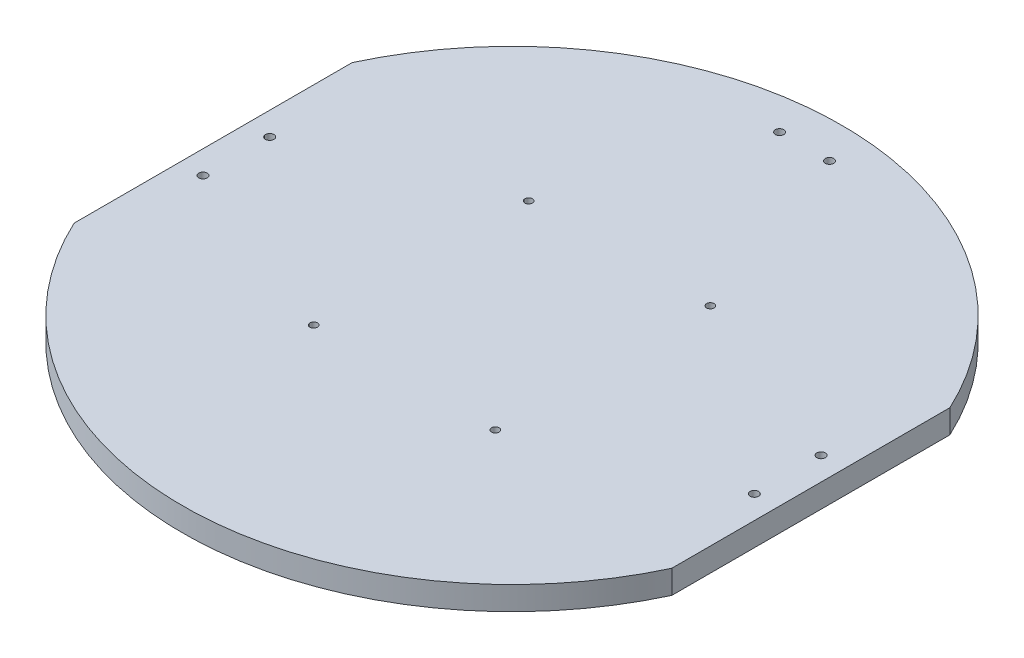
from build123d import *

# Parameters (mm, degrees)
MAIN_BODY_DEPTH    = 6.35
RASPBERRY_PI_REACH = 122.169
SKETCH2_R          = 1.025
MOTOR_MOUNTS_REACH = 122.169
SKETCH3_R          = 1.143
CUT_EXTRUDE3_REACH = 122.169
SKETCH4_R          = 1.143


with BuildPart() as part:
    # Sketch1 → Main Body (new body)
    with BuildSketch(Plane(origin=(0, 0, 0), x_dir=(1, 0, 0), z_dir=(0, 1, 0))):
        with BuildLine():
            Line((-80.603721998, 37.5), (-80.603721998, -37.5))
            ThreePointArc((-80.603721998, -37.5), (0, -88.9), (80.603721998, -37.5))
            Line((80.603721998, -37.5), (80.603721998, 37.5))
            ThreePointArc((80.603721998, 37.5), (0, 88.9), (-80.603721998, 37.5))
        make_face()
    extrude(amount=MAIN_BODY_DEPTH)

    # Sketch2 → Raspberry Pi (cut, up to next)
    with BuildSketch(Plane(origin=(0, 6.35, 0), x_dir=(1, 0, 0), z_dir=(0, 1, 0)), mode=Mode.PRIVATE) as raspberry_pi_sk1:
        with Locations((24.5, 29)):
            Circle(SKETCH2_R)
    raspberry_pi_tool1 = extrude(raspberry_pi_sk1.sketch, amount=-RASPBERRY_PI_REACH, mode=Mode.PRIVATE) & part.part
    # Sketch2 → Raspberry Pi (cut, up to next)
    with BuildSketch(Plane(origin=(0, 6.35, 0), x_dir=(1, 0, 0), z_dir=(0, 1, 0)), mode=Mode.PRIVATE) as raspberry_pi_sk2:
        with Locations((24.5, -29)):
            Circle(SKETCH2_R)
    raspberry_pi_tool2 = extrude(raspberry_pi_sk2.sketch, amount=-RASPBERRY_PI_REACH, mode=Mode.PRIVATE) & part.part
    # Sketch2 → Raspberry Pi (cut, up to next)
    with BuildSketch(Plane(origin=(0, 6.35, 0), x_dir=(1, 0, 0), z_dir=(0, 1, 0)), mode=Mode.PRIVATE) as raspberry_pi_sk3:
        with Locations((-24.5, -29)):
            Circle(SKETCH2_R)
    raspberry_pi_tool3 = extrude(raspberry_pi_sk3.sketch, amount=-RASPBERRY_PI_REACH, mode=Mode.PRIVATE) & part.part
    # Sketch2 → Raspberry Pi (cut, up to next)
    with BuildSketch(Plane(origin=(0, 6.35, 0), x_dir=(1, 0, 0), z_dir=(0, 1, 0)), mode=Mode.PRIVATE) as raspberry_pi_sk4:
        with Locations((-24.5, 29)):
            Circle(SKETCH2_R)
    raspberry_pi_tool4 = extrude(raspberry_pi_sk4.sketch, amount=-RASPBERRY_PI_REACH, mode=Mode.PRIVATE) & part.part
    add(raspberry_pi_tool1.solids().sort_by_distance((24.5, 6.35, -29))[0], mode=Mode.SUBTRACT)
    add(raspberry_pi_tool2.solids().sort_by_distance((24.5, 6.35, 29))[0], mode=Mode.SUBTRACT)
    add(raspberry_pi_tool3.solids().sort_by_distance((-24.5, 6.35, 29))[0], mode=Mode.SUBTRACT)
    add(raspberry_pi_tool4.solids().sort_by_distance((-24.5, 6.35, -29))[0], mode=Mode.SUBTRACT)

    # Sketch3 → Motor Mounts (cut, up to next)
    with BuildSketch(Plane(origin=(0, 6.35, 0), x_dir=(1, 0, 0), z_dir=(0, 1, 0)), mode=Mode.PRIVATE) as motor_mounts_sk1:
        with Locations((-74.353721998, 9)):
            Circle(SKETCH3_R)
    motor_mounts_tool1 = extrude(motor_mounts_sk1.sketch, amount=-MOTOR_MOUNTS_REACH, mode=Mode.PRIVATE) & part.part
    # Sketch3 → Motor Mounts (cut, up to next)
    with BuildSketch(Plane(origin=(0, 6.35, 0), x_dir=(1, 0, 0), z_dir=(0, 1, 0)), mode=Mode.PRIVATE) as motor_mounts_sk2:
        with Locations((-74.353721998, -9)):
            Circle(SKETCH3_R)
    motor_mounts_tool2 = extrude(motor_mounts_sk2.sketch, amount=-MOTOR_MOUNTS_REACH, mode=Mode.PRIVATE) & part.part
    # Sketch3 → Motor Mounts (cut, up to next)
    with BuildSketch(Plane(origin=(0, 6.35, 0), x_dir=(1, 0, 0), z_dir=(0, 1, 0)), mode=Mode.PRIVATE) as motor_mounts_sk3:
        with Locations((74.353721998, 9)):
            Circle(SKETCH3_R)
    motor_mounts_tool3 = extrude(motor_mounts_sk3.sketch, amount=-MOTOR_MOUNTS_REACH, mode=Mode.PRIVATE) & part.part
    # Sketch3 → Motor Mounts (cut, up to next)
    with BuildSketch(Plane(origin=(0, 6.35, 0), x_dir=(1, 0, 0), z_dir=(0, 1, 0)), mode=Mode.PRIVATE) as motor_mounts_sk4:
        with Locations((74.353721998, -9)):
            Circle(SKETCH3_R)
    motor_mounts_tool4 = extrude(motor_mounts_sk4.sketch, amount=-MOTOR_MOUNTS_REACH, mode=Mode.PRIVATE) & part.part
    add(motor_mounts_tool1.solids().sort_by_distance((-74.353722, 6.35, -9))[0], mode=Mode.SUBTRACT)
    add(motor_mounts_tool2.solids().sort_by_distance((-74.353722, 6.35, 9))[0], mode=Mode.SUBTRACT)
    add(motor_mounts_tool3.solids().sort_by_distance((74.353722, 6.35, -9))[0], mode=Mode.SUBTRACT)
    add(motor_mounts_tool4.solids().sort_by_distance((74.353722, 6.35, 9))[0], mode=Mode.SUBTRACT)

    # Sketch4 → Cut-Extrude3 (cut, up to next)
    with BuildSketch(Plane(origin=(0, 6.35, 0), x_dir=(1, 0, 0), z_dir=(0, 1, 0)), mode=Mode.PRIVATE) as cut_extrude3_sk1:
        with Locations((-6.731, 78.9)):
            Circle(SKETCH4_R)
    cut_extrude3_tool1 = extrude(cut_extrude3_sk1.sketch, amount=-CUT_EXTRUDE3_REACH, mode=Mode.PRIVATE) & part.part
    # Sketch4 → Cut-Extrude3 (cut, up to next)
    with BuildSketch(Plane(origin=(0, 6.35, 0), x_dir=(1, 0, 0), z_dir=(0, 1, 0)), mode=Mode.PRIVATE) as cut_extrude3_sk2:
        with Locations((6.731, 78.9)):
            Circle(SKETCH4_R)
    cut_extrude3_tool2 = extrude(cut_extrude3_sk2.sketch, amount=-CUT_EXTRUDE3_REACH, mode=Mode.PRIVATE) & part.part
    add(cut_extrude3_tool1.solids().sort_by_distance((-6.731, 6.35, -78.9))[0], mode=Mode.SUBTRACT)
    add(cut_extrude3_tool2.solids().sort_by_distance((6.731, 6.35, -78.9))[0], mode=Mode.SUBTRACT)


solid = part.part
